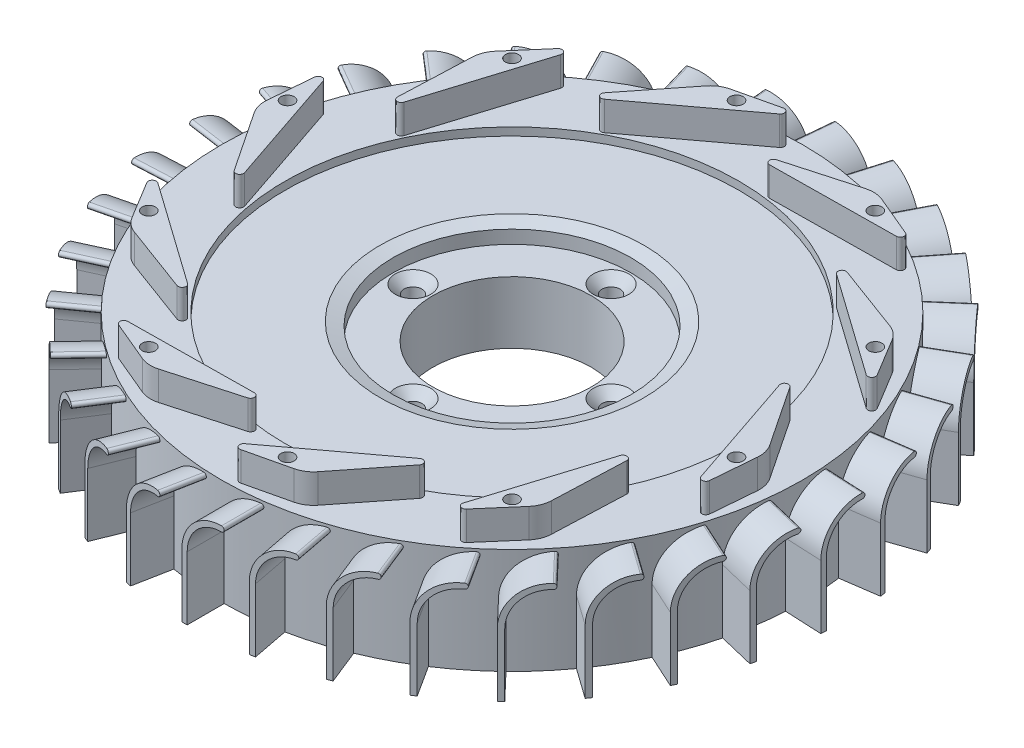
from build123d import *

# Parameters (mm, degrees)
Y_KSEKLIK_EKSTR_ZYON1_DEPTH                        = 9
DAIRESEL_KAPLAMA1_COUNT                            = 33
Y_KSEKLIK_EKSTR_ZYON2_DEPTH                        = 5.5
DAIRESEL_KAPLAMA3_COUNT                            = 10
M3_DI_LI_DELIK2_D                                  = 2.5
DAIRESEL_KAPLAMA4_COUNT                            = 10
M3_ALT_GEN_ALYAN_HAV_A_BA_L_K_R_VIDA_I_D           = 3.4
M3_ALT_GEN_ALYAN_HAV_A_BA_L_K_R_VIDA_I_CSINK_D     = 6.72
M3_ALT_GEN_ALYAN_HAV_A_BA_L_K_R_VIDA_I_CSINK_ANGLE = 90
DAIRESEL_KAPLAMA5_COUNT                            = 4


with BuildPart() as part:
    # Çizim1 → Döndür1 (revolve)
    with BuildSketch(Plane.XY):
        with BuildLine():
            Line((-55, 25.492719719), (-43, 25.492719719))
            Line((-43, 25.492719719), (-43, 23.992719719))
            Line((-43, 23.992719719), (-25, 23.992719719))
            Line((-25, 23.992719719), (-22.5, 23.228393015))
            Line((-22.5, 23.228393015), (-22.5, 20.742719719))
            Line((-22.5, 20.742719719), (-15, 20.742719719))
            Line((-15, 20.742719719), (-15, 8.992719719))
            Line((-15, 8.992719719), (-22.5, 8.992719719))
            Line((-22.5, 8.992719719), (-22.5, 3.992719719))
            Line((-22.5, 3.992719719), (-24.5, 3.992719719))
            Line((-24.5, 3.992719719), (-29.83, 15.492719719))
            Line((-29.83, 15.492719719), (-47, 15.492719719))
            ThreePointArc((-47, 15.492719719), (-50.535533906, 14.028253625), (-52, 10.492719719))
            Line((-52, 10.492719719), (-52, 5.492719719))
            Line((-52, 5.492719719), (-55, 5.492719719))
            Line((-55, 5.492719719), (-55, 25.492719719))
        make_face()
    revolve(axis=Axis((0, -11.024229075, 0), (0, 1, 0)))

    # Çizim2 → Yükseklik-Ekstrüzyon1 (add)
    with BuildSketch(Plane.XY.offset(53)):
        with BuildLine():
            Line((0.5, 5.492719719), (0.5, 17.492719719))
            ThreePointArc((0.5, 17.492719719), (2.403805922, 22.088913796), (7, 23.992719719))
            ThreePointArc((7, 23.992719719), (7.5, 24.492719719), (7, 24.992719719))
            ThreePointArc((7, 24.992719719), (1.696699141, 22.796020578), (-0.5, 17.492719719))
            Line((-0.5, 17.492719719), (-0.5, 5.492719719))
            Line((-0.5, 5.492719719), (0.5, 5.492719719))
        make_face()
    y_kseklik_ekstr_zyon1 = extrude(amount=Y_KSEKLIK_EKSTR_ZYON1_DEPTH)

    # Dairesel Kaplama1: Yükseklik-Ekstrüzyon1 ×33 about axis
    dairesel_kaplama1_axis = Axis((0, 5.492719719, 0), (0, -1, 0))
    for i in range(1, DAIRESEL_KAPLAMA1_COUNT):
        add(y_kseklik_ekstr_zyon1.rotate(dairesel_kaplama1_axis, i * 360 / DAIRESEL_KAPLAMA1_COUNT))

    # Çizim9 → Yükseklik-Ekstrüzyon2 (add)
    with BuildSketch(Plane(origin=(0, 25.492719719, 0), x_dir=(1, 0, 0), z_dir=(0, 1, 0))):
        with BuildLine():
            Line((5.484601828, 44.540405983), (18.666148574, 48.242576917))
            ThreePointArc((18.666148574, 48.242576917), (20.328326911, 48.41920235), (21.955838032, 48.038097488))
            Line((21.955838032, 48.038097488), (29.672103875, 44.794235914))
            ThreePointArc((29.672103875, 44.794235914), (30.117526918, 43.959009822), (29.390453586, 43.352900359))
            Line((29.390453586, 43.352900359), (5.696404958, 43.068398514))
            ThreePointArc((5.696404958, 43.068398514), (4.945045441, 43.711529069), (5.484601828, 44.540405983))
        make_face()
    y_kseklik_ekstr_zyon2 = extrude(amount=Y_KSEKLIK_EKSTR_ZYON2_DEPTH)

    # Dairesel Kaplama3: Yükseklik-Ekstrüzyon2 ×10 about axis
    dairesel_kaplama3_axis = Axis((0, 25.492719719, 0), (0, -1, 0))
    for i in range(1, DAIRESEL_KAPLAMA3_COUNT):
        add(y_kseklik_ekstr_zyon2.rotate(dairesel_kaplama3_axis, i * 360 / DAIRESEL_KAPLAMA3_COUNT))

    # M3 Dişli Delik2 (through all)
    with Locations(Plane(origin=(0, 30.992719719, 0), x_dir=(1, 0, 0), z_dir=(0, 1, 0))):
        with Locations((-8, 50.5)):
            m3_di_li_delik2 = Hole(M3_DI_LI_DELIK2_D / 2)

    # Dairesel Kaplama4: M3 Dişli Delik2 ×10 about axis
    dairesel_kaplama4_axis = Axis((0, 25.492719719, 0), (0, -1, 0))
    for i in range(1, DAIRESEL_KAPLAMA4_COUNT):
        add(m3_di_li_delik2.rotate(dairesel_kaplama4_axis, i * 360 / DAIRESEL_KAPLAMA4_COUNT), mode=Mode.SUBTRACT)

    # M3 Altıgen Alyan Havşa Başlı Kör Vida İçin Havşa1 (through all)
    with Locations(Plane(origin=(0, 20.742719719, -18.75), x_dir=(0, 0, 1), z_dir=(0, 1, 0))):
        with Locations((0, 0)):
            m3_alt_gen_alyan_hav_a_ba_l_k_r_vida_i = CounterSinkHole(M3_ALT_GEN_ALYAN_HAV_A_BA_L_K_R_VIDA_I_D / 2, M3_ALT_GEN_ALYAN_HAV_A_BA_L_K_R_VIDA_I_CSINK_D / 2, counter_sink_angle=M3_ALT_GEN_ALYAN_HAV_A_BA_L_K_R_VIDA_I_CSINK_ANGLE)

    # Dairesel Kaplama5: M3 Altıgen Alyan Havşa Başlı Kör Vida İçin Havşa1 ×4 about axis
    dairesel_kaplama5_axis = Axis((0, 20.742719719, 0), (0, -1, 0))
    for i in range(1, DAIRESEL_KAPLAMA5_COUNT):
        add(m3_alt_gen_alyan_hav_a_ba_l_k_r_vida_i.rotate(dairesel_kaplama5_axis, i * 360 / DAIRESEL_KAPLAMA5_COUNT), mode=Mode.SUBTRACT)


solid = part.part
